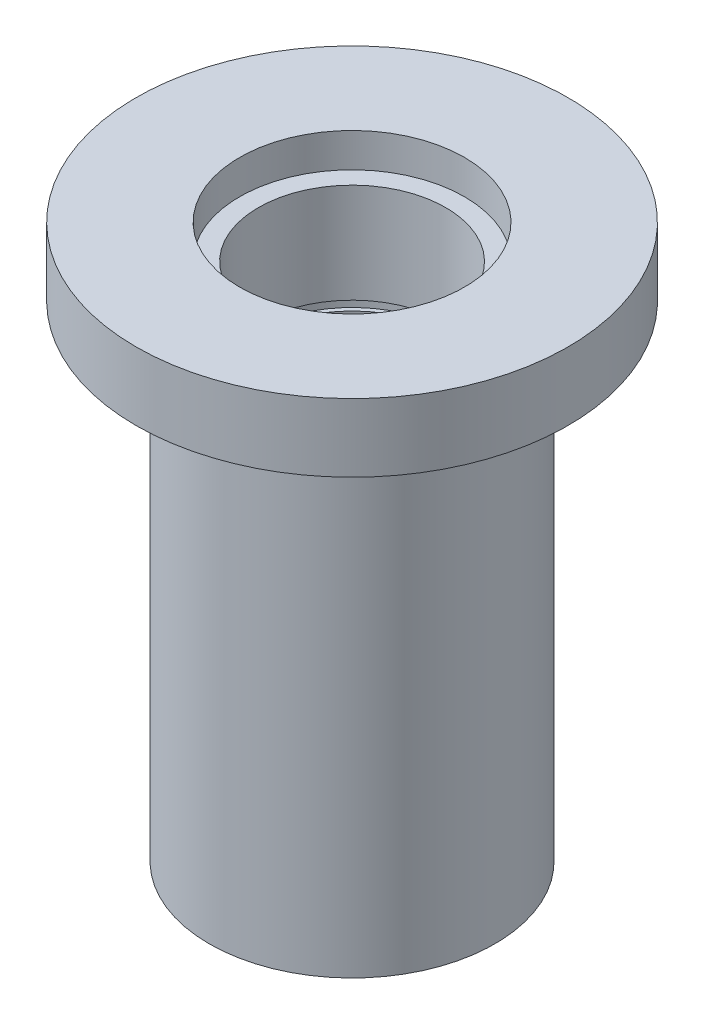
from build123d import *


with BuildPart() as part:
    # Sketch1 → Revolve1 (revolve)
    with BuildSketch(Plane.XY):
        Polygon((25.360660356, 0), (13.2, 0), (13.2, -4), (11, -4), (11, -15.7), (11.5, -15.7), (11.5, -16.8), (11, -16.8), (11, -31.2), (11.5, -31.2), (11.5, -32.3), (11, -32.3), (11, -65), (16.774263553, -65), (16.774263553, -8), (25.360660356, -8), align=None)
    revolve(axis=Axis((0, 0, 0), (0, -1, 0)))


solid = part.part
